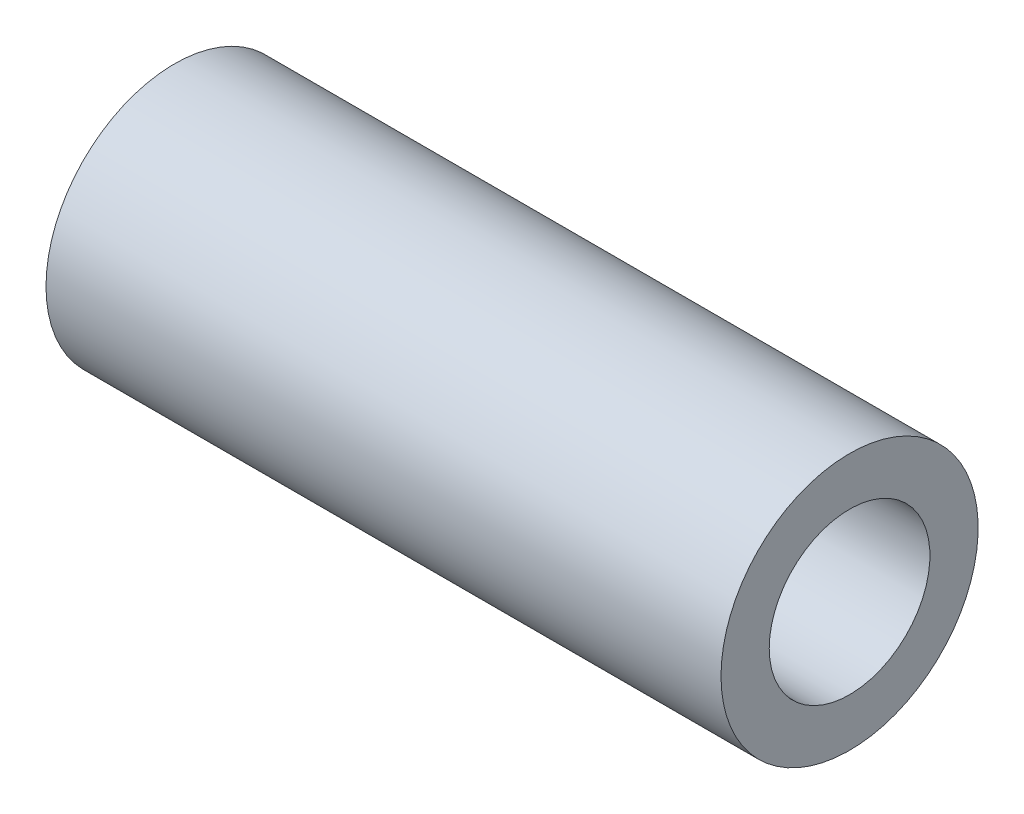
from build123d import *

# Parameters (mm, degrees)
SKETCH1_R           = 4
SKETCH1_R_2         = 2.5
BOSS_EXTRUDE1_DEPTH = 10.5


with BuildPart() as part:
    # Sketch1 → Boss-Extrude1 (new, symmetric)
    with BuildSketch(Plane(origin=(0, 0, 0), x_dir=(0, 0, -1), z_dir=(1, 0, 0))):
        Circle(SKETCH1_R)
        Circle(SKETCH1_R_2, mode=Mode.SUBTRACT)
    extrude(amount=BOSS_EXTRUDE1_DEPTH, both=True)


solid = part.part
